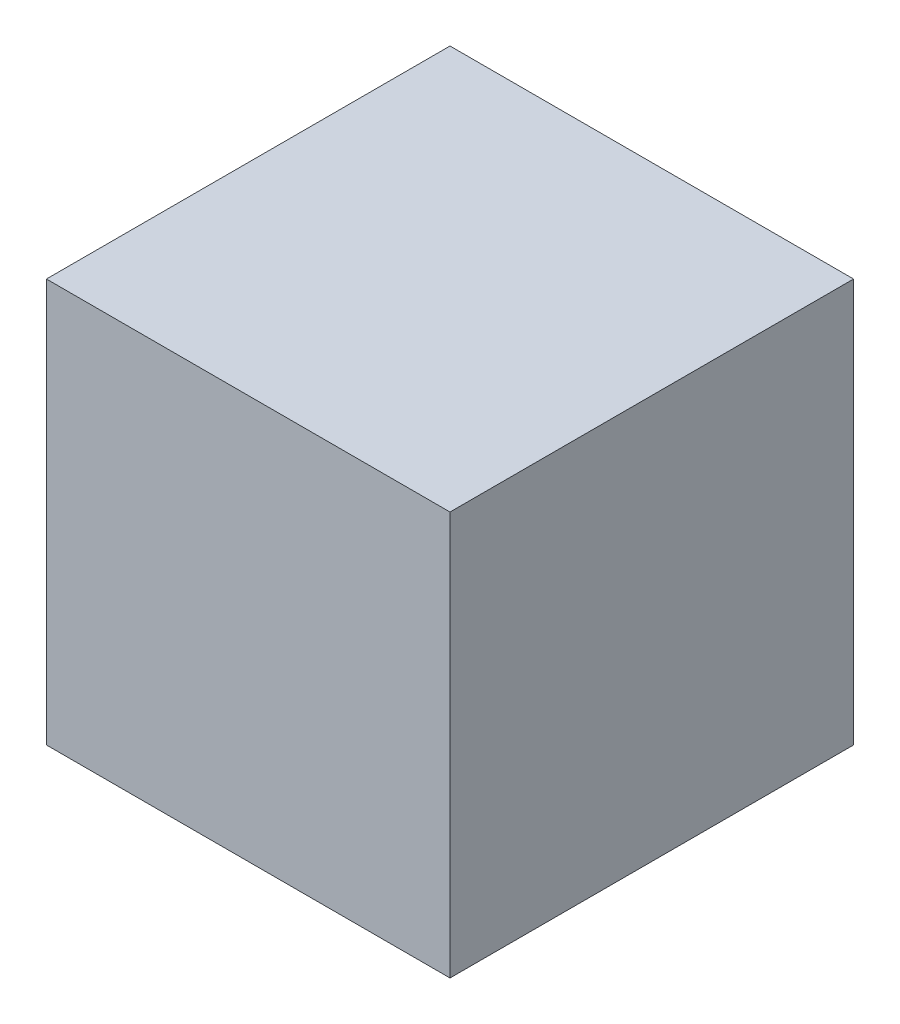
from build123d import *

# Parameters (mm, degrees)
SKETCH1_W           = 28.8
SKETCH1_H           = 28.8
BOSS_EXTRUDE1_DEPTH = 28.8


with BuildPart() as part:
    # Sketch1 → Boss-Extrude1 (new body)
    with BuildSketch(Plane.XY):
        with Locations((14.4, 14.4)):
            Rectangle(SKETCH1_W, SKETCH1_H)
    extrude(amount=BOSS_EXTRUDE1_DEPTH)


solid = part.part
